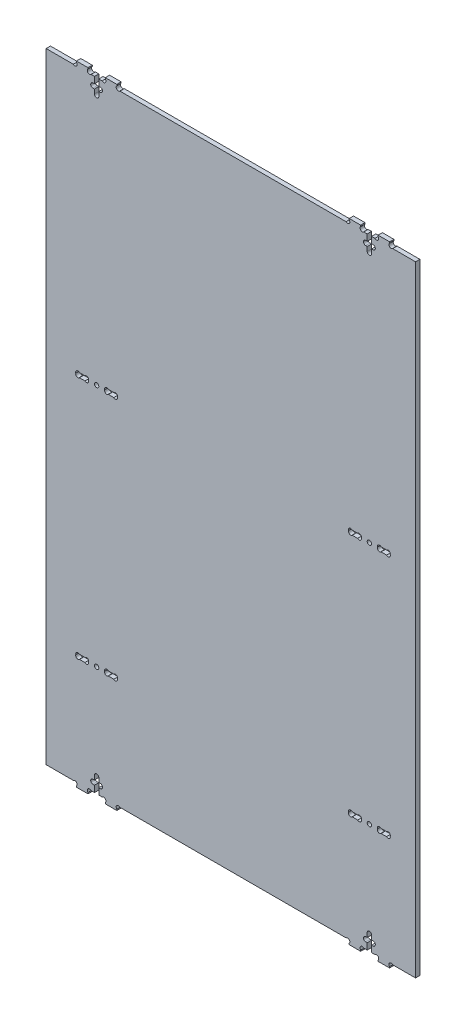
from build123d import *

# Parameters (mm, degrees)
SKETCH_1_W                      = 518
SKETCH_1_H                      = 871.6
EXTRUDE_1_DEPTH                 = 6
CUT_EXTRUDE_5_DEPTH             = 677.965021253
CUT_EXTRUDE_5_DEPTH_BACK        = 677.965021253
SKETCH_5_R                      = 2.75
SKETCH_5_W                      = 16.15
SKETCH_5_H                      = 6.15
SKETCH_5_W_2                    = 322
SKETCH_5_H_2                    = 6
SKETCH_5_W_3                    = 42.1
CUT_EXTRUDE_6_01_DEPTH          = 677.965021253
CUT_EXTRUDE_6_01_DEPTH_BACK     = 677.965021253
SKETCH_6_01_W                   = 6
SKETCH_6_01_H                   = 21.2
CUT_EXTRUDE_6_01_2_DEPTH        = 677.965021253
CUT_EXTRUDE_6_01_2_DEPTH_BACK   = 677.965021253
SKETCH_6_01_2_W                 = 10.3
SKETCH_6_01_2_H                 = 6.2
CUT_EXTRUDE_6_01_1_DEPTH        = 677.965021253
CUT_EXTRUDE_6_01_1_DEPTH_BACK   = 677.965021253
SKETCH_6_01_1_R                 = 3.05
CUT_EXTRUDE_6_01_1_2_DEPTH      = 677.965021253
CUT_EXTRUDE_6_01_1_2_DEPTH_BACK = 677.965021253
SKETCH_6_01_1_2_R               = 3.05
CUT_EXTRUDE_6_01_3_DEPTH        = 677.965021253
CUT_EXTRUDE_6_01_3_DEPTH_BACK   = 677.965021253
SKETCH_6_01_3_R                 = 3
CUT_EXTRUDE_6_02_DEPTH          = 677.965021253
CUT_EXTRUDE_6_02_DEPTH_BACK     = 677.965021253
SKETCH_6_02_W                   = 6
SKETCH_6_02_H                   = 21.2
CUT_EXTRUDE_6_02_2_DEPTH        = 677.965021253
CUT_EXTRUDE_6_02_2_DEPTH_BACK   = 677.965021253
SKETCH_6_02_2_W                 = 10.3
SKETCH_6_02_2_H                 = 6.2
CUT_EXTRUDE_6_02_1_DEPTH        = 677.965021253
CUT_EXTRUDE_6_02_1_DEPTH_BACK   = 677.965021253
SKETCH_6_02_1_R                 = 3.05
CUT_EXTRUDE_6_02_1_2_DEPTH      = 677.965021253
CUT_EXTRUDE_6_02_1_2_DEPTH_BACK = 677.965021253
SKETCH_6_02_1_2_R               = 3.05
CUT_EXTRUDE_6_02_3_DEPTH        = 677.965021253
CUT_EXTRUDE_6_02_3_DEPTH_BACK   = 677.965021253
SKETCH_6_02_3_R                 = 3
CUT_EXTRUDE_6_03_DEPTH          = 677.965021253
CUT_EXTRUDE_6_03_DEPTH_BACK     = 677.965021253
SKETCH_6_03_W                   = 6
SKETCH_6_03_H                   = 21.2
CUT_EXTRUDE_6_03_2_DEPTH        = 677.965021253
CUT_EXTRUDE_6_03_2_DEPTH_BACK   = 677.965021253
SKETCH_6_03_2_W                 = 10.3
SKETCH_6_03_2_H                 = 6.2
CUT_EXTRUDE_6_03_1_DEPTH        = 677.965021253
CUT_EXTRUDE_6_03_1_DEPTH_BACK   = 677.965021253
SKETCH_6_03_1_R                 = 3.05
CUT_EXTRUDE_6_03_1_2_DEPTH      = 677.965021253
CUT_EXTRUDE_6_03_1_2_DEPTH_BACK = 677.965021253
SKETCH_6_03_1_2_R               = 3.05
CUT_EXTRUDE_6_03_3_DEPTH        = 677.965021253
CUT_EXTRUDE_6_03_3_DEPTH_BACK   = 677.965021253
SKETCH_6_03_3_R                 = 3
CUT_EXTRUDE_6_04_DEPTH          = 677.965021253
CUT_EXTRUDE_6_04_DEPTH_BACK     = 677.965021253
SKETCH_6_04_W                   = 6
SKETCH_6_04_H                   = 21.2
CUT_EXTRUDE_6_04_2_DEPTH        = 677.965021253
CUT_EXTRUDE_6_04_2_DEPTH_BACK   = 677.965021253
SKETCH_6_04_2_W                 = 10.3
SKETCH_6_04_2_H                 = 6.2
CUT_EXTRUDE_6_04_1_DEPTH        = 677.965021253
CUT_EXTRUDE_6_04_1_DEPTH_BACK   = 677.965021253
SKETCH_6_04_1_R                 = 3.05
CUT_EXTRUDE_6_04_1_2_DEPTH      = 677.965021253
CUT_EXTRUDE_6_04_1_2_DEPTH_BACK = 677.965021253
SKETCH_6_04_1_2_R               = 3.05
CUT_EXTRUDE_6_04_3_DEPTH        = 677.965021253
CUT_EXTRUDE_6_04_3_DEPTH_BACK   = 677.965021253
SKETCH_6_04_3_R                 = 3
CUT_EXTRUDE_01_DEPTH            = 677.965021253
CUT_EXTRUDE_01_DEPTH_BACK       = 677.965021253
SKETCH_01_R                     = 3.05
CUT_EXTRUDE_02_DEPTH            = 677.965021253
CUT_EXTRUDE_02_DEPTH_BACK       = 677.965021253
SKETCH_02_R                     = 3.05
CUT_EXTRUDE_03_DEPTH            = 677.965021253
CUT_EXTRUDE_03_DEPTH_BACK       = 677.965021253
SKETCH_03_R                     = 3.05
CUT_EXTRUDE_04_DEPTH            = 677.965021253
CUT_EXTRUDE_04_DEPTH_BACK       = 677.965021253
SKETCH_04_R                     = 3.05
SKETCH_6_01_4_R                 = 10
EXTRUDE_6_01_20_DEPTH           = 6
CUT_EXTRUDE_6_01_4_DEPTH        = 677.965021253
CUT_EXTRUDE_6_01_4_DEPTH_BACK   = 677.965021253
SKETCH_6_01_5_R                 = 3
SKETCH_6_02_4_R                 = 10
EXTRUDE_6_02_20_DEPTH           = 6
CUT_EXTRUDE_6_02_4_DEPTH        = 677.965021253
CUT_EXTRUDE_6_02_4_DEPTH_BACK   = 677.965021253
SKETCH_6_02_5_R                 = 3
SKETCH_6_03_4_R                 = 10
EXTRUDE_6_03_20_DEPTH           = 6
CUT_EXTRUDE_6_03_4_DEPTH        = 677.965021253
CUT_EXTRUDE_6_03_4_DEPTH_BACK   = 677.965021253
SKETCH_6_03_5_R                 = 3
SKETCH_6_04_4_R                 = 10
EXTRUDE_6_04_20_DEPTH           = 6
CUT_EXTRUDE_6_04_4_DEPTH        = 677.965021253
CUT_EXTRUDE_6_04_4_DEPTH_BACK   = 677.965021253
SKETCH_6_04_5_R                 = 3


with BuildPart() as part:
    # Эскиз1 → Бобышка-Вытянуть1 (new body)
    with BuildSketch(Plane.XY):
        with Locations((-259, 0)):
            Rectangle(SKETCH_1_W, SKETCH_1_H)
    extrude(amount=-EXTRUDE_1_DEPTH)

    # Стыки_эскиз_пазов_и_стяжек_М5 → Стыки_шип_паз_стяжки_М5 (cut, two sides: drawn at the far end of the back side and taken through both)
    with BuildSketch(Plane.XY.offset(-CUT_EXTRUDE_5_DEPTH_BACK)):
        with Locations((-448, -277.2)):
            Circle(SKETCH_5_R)
        with Locations((-448, 60.8)):
            Circle(SKETCH_5_R)
        with Locations((-70, -277.2)):
            Circle(SKETCH_5_R)
        with Locations((-70, 60.8)):
            Circle(SKETCH_5_R)
        Polygon((-72.75, -415.65), (-74.15, -415.65), (-74.15, -419.95), (-72.75, -419.95), (-72.75, -429.8), (-82, -429.8), (-82, -435.8), (-72.75, -435.8), (-72.75, -435.9), (-67.25, -435.9), (-67.25, -435.8), (-58, -435.8), (-58, -429.8), (-67.25, -429.8), (-67.25, -419.95), (-65.85, -419.95), (-65.85, -415.65), (-67.25, -415.65), (-67.25, -408.8), (-72.75, -408.8), align=None)
        Polygon((-445.25, 419.95), (-445.25, 429.8), (-436, 429.8), (-436, 435.8), (-445.25, 435.8), (-445.25, 435.9), (-450.75, 435.9), (-450.75, 435.8), (-460, 435.8), (-460, 429.8), (-450.75, 429.8), (-450.75, 419.95), (-452.15, 419.95), (-452.15, 415.65), (-450.75, 415.65), (-450.75, 408.8), (-445.25, 408.8), (-445.25, 415.65), (-443.85, 415.65), (-443.85, 419.95), align=None)
        Polygon((-6, -429.8), (-42, -429.8), (-42, -435.8), (0.1, -435.8), (0.1, -429.8), (0, -429.8), (0, 429.8), (0.1, 429.8), (0.1, 435.8), (-42, 435.8), (-42, 429.8), (-6, 429.8), align=None)
        Polygon((-67.25, 435.8), (-67.25, 435.9), (-72.75, 435.9), (-72.75, 435.8), (-82, 435.8), (-82, 429.8), (-72.75, 429.8), (-72.75, 419.95), (-74.15, 419.95), (-74.15, 415.65), (-72.75, 415.65), (-72.75, 408.8), (-67.25, 408.8), (-67.25, 415.65), (-65.85, 415.65), (-65.85, 419.95), (-67.25, 419.95), (-67.25, 429.8), (-58, 429.8), (-58, 435.8), align=None)
        with Locations((-468, 60.8)):
            Rectangle(SKETCH_5_W, SKETCH_5_H)
        with Locations((-259, -432.8)):
            Rectangle(SKETCH_5_W_2, SKETCH_5_H_2)
        with Locations((-90, -277.2)):
            Rectangle(SKETCH_5_W, SKETCH_5_H)
        with Locations((-497.05, 432.8)):
            Rectangle(SKETCH_5_W_3, SKETCH_5_H_2)
        with Locations((-90, 60.8)):
            Rectangle(SKETCH_5_W, SKETCH_5_H)
        with Locations((-50, 60.8)):
            Rectangle(SKETCH_5_W, SKETCH_5_H)
        Polygon((-443.85, -419.95), (-443.85, -415.65), (-445.25, -415.65), (-445.25, -408.8), (-450.75, -408.8), (-450.75, -415.65), (-452.15, -415.65), (-452.15, -419.95), (-450.75, -419.95), (-450.75, -429.8), (-460, -429.8), (-460, -435.8), (-450.75, -435.8), (-450.75, -435.9), (-445.25, -435.9), (-445.25, -435.8), (-436, -435.8), (-436, -429.8), (-445.25, -429.8), (-445.25, -419.95), align=None)
        with Locations((-468, -277.2)):
            Rectangle(SKETCH_5_W, SKETCH_5_H)
        with Locations((-50, -277.2)):
            Rectangle(SKETCH_5_W, SKETCH_5_H)
        with Locations((-428, -277.2)):
            Rectangle(SKETCH_5_W, SKETCH_5_H)
        with Locations((-428, 60.8)):
            Rectangle(SKETCH_5_W, SKETCH_5_H)
        with Locations((-497.05, -432.8)):
            Rectangle(SKETCH_5_W_3, SKETCH_5_H_2)
        with Locations((-259, 432.8)):
            Rectangle(SKETCH_5_W_2, SKETCH_5_H_2)
    extrude(amount=CUT_EXTRUDE_5_DEPTH + CUT_EXTRUDE_5_DEPTH_BACK, mode=Mode.SUBTRACT)

    # Sketch 6_01 → Cut-Extrude 6_01 (cut, two sides: drawn at the far end of the back side and taken through both)
    with BuildSketch(Plane.XY.offset(-CUT_EXTRUDE_6_01_DEPTH_BACK)):
        with Locations((-70, -419.3)):
            Rectangle(SKETCH_6_01_W, SKETCH_6_01_H)
    extrude(amount=CUT_EXTRUDE_6_01_DEPTH + CUT_EXTRUDE_6_01_DEPTH_BACK, mode=Mode.SUBTRACT)

    # Sketch 6_01 2 → Cut-Extrude 6_01 2 (cut, two sides: drawn at the far end of the back side and taken through both)
    with BuildSketch(Plane.XY.offset(-CUT_EXTRUDE_6_01_2_DEPTH_BACK)):
        with Locations((-70, -417.8)):
            Rectangle(SKETCH_6_01_2_W, SKETCH_6_01_2_H)
    extrude(amount=CUT_EXTRUDE_6_01_2_DEPTH + CUT_EXTRUDE_6_01_2_DEPTH_BACK, mode=Mode.SUBTRACT)

    # Sketch 6_01_____1 → Cut-Extrude 6_01_____1 (cut, two sides: drawn at the far end of the back side and taken through both)
    with BuildSketch(Plane.XY.offset(-CUT_EXTRUDE_6_01_1_DEPTH_BACK)):
        with Locations((-64.85, -417.75)):
            Circle(SKETCH_6_01_1_R)
        with Locations((-75.15, -417.75)):
            Circle(SKETCH_6_01_1_R)
    extrude(amount=CUT_EXTRUDE_6_01_1_DEPTH + CUT_EXTRUDE_6_01_1_DEPTH_BACK, mode=Mode.SUBTRACT)

    # Sketch 6_01_____-1 2 → Cut-Extrude 6_01_____-1 2 (cut, two sides: drawn at the far end of the back side and taken through both)
    with BuildSketch(Plane.XY.offset(-CUT_EXTRUDE_6_01_1_2_DEPTH_BACK)):
        with Locations((-64.85, -417.85)):
            Circle(SKETCH_6_01_1_2_R)
        with Locations((-75.15, -417.85)):
            Circle(SKETCH_6_01_1_2_R)
    extrude(amount=CUT_EXTRUDE_6_01_1_2_DEPTH + CUT_EXTRUDE_6_01_1_2_DEPTH_BACK, mode=Mode.SUBTRACT)

    # Sketch 6_01 3 → Cut-Extrude 6_01 3 (cut, two sides: drawn at the far end of the back side and taken through both)
    with BuildSketch(Plane.XY.offset(-CUT_EXTRUDE_6_01_3_DEPTH_BACK)):
        with Locations((-70, -408.7)):
            Circle(SKETCH_6_01_3_R)
    extrude(amount=CUT_EXTRUDE_6_01_3_DEPTH + CUT_EXTRUDE_6_01_3_DEPTH_BACK, mode=Mode.SUBTRACT)

    # Sketch 6_02 → Cut-Extrude 6_02 (cut, two sides: drawn at the far end of the back side and taken through both)
    with BuildSketch(Plane.XY.offset(-CUT_EXTRUDE_6_02_DEPTH_BACK)):
        with Locations((-70, 419.3)):
            Rectangle(SKETCH_6_02_W, SKETCH_6_02_H)
    extrude(amount=CUT_EXTRUDE_6_02_DEPTH + CUT_EXTRUDE_6_02_DEPTH_BACK, mode=Mode.SUBTRACT)

    # Sketch 6_02 2 → Cut-Extrude 6_02 2 (cut, two sides: drawn at the far end of the back side and taken through both)
    with BuildSketch(Plane.XY.offset(-CUT_EXTRUDE_6_02_2_DEPTH_BACK)):
        with Locations((-70, 417.8)):
            Rectangle(SKETCH_6_02_2_W, SKETCH_6_02_2_H)
    extrude(amount=CUT_EXTRUDE_6_02_2_DEPTH + CUT_EXTRUDE_6_02_2_DEPTH_BACK, mode=Mode.SUBTRACT)

    # Sketch 6_02_____1 → Cut-Extrude 6_02_____1 (cut, two sides: drawn at the far end of the back side and taken through both)
    with BuildSketch(Plane.XY.offset(-CUT_EXTRUDE_6_02_1_DEPTH_BACK)):
        with Locations((-64.85, 417.85)):
            Circle(SKETCH_6_02_1_R)
        with Locations((-75.15, 417.85)):
            Circle(SKETCH_6_02_1_R)
    extrude(amount=CUT_EXTRUDE_6_02_1_DEPTH + CUT_EXTRUDE_6_02_1_DEPTH_BACK, mode=Mode.SUBTRACT)

    # Sketch 6_02_____-1 2 → Cut-Extrude 6_02_____-1 2 (cut, two sides: drawn at the far end of the back side and taken through both)
    with BuildSketch(Plane.XY.offset(-CUT_EXTRUDE_6_02_1_2_DEPTH_BACK)):
        with Locations((-64.85, 417.75)):
            Circle(SKETCH_6_02_1_2_R)
        with Locations((-75.15, 417.75)):
            Circle(SKETCH_6_02_1_2_R)
    extrude(amount=CUT_EXTRUDE_6_02_1_2_DEPTH + CUT_EXTRUDE_6_02_1_2_DEPTH_BACK, mode=Mode.SUBTRACT)

    # Sketch 6_02 3 → Cut-Extrude 6_02 3 (cut, two sides: drawn at the far end of the back side and taken through both)
    with BuildSketch(Plane.XY.offset(-CUT_EXTRUDE_6_02_3_DEPTH_BACK)):
        with Locations((-70, 408.7)):
            Circle(SKETCH_6_02_3_R)
    extrude(amount=CUT_EXTRUDE_6_02_3_DEPTH + CUT_EXTRUDE_6_02_3_DEPTH_BACK, mode=Mode.SUBTRACT)

    # Sketch 6_03 → Cut-Extrude 6_03 (cut, two sides: drawn at the far end of the back side and taken through both)
    with BuildSketch(Plane.XY.offset(-CUT_EXTRUDE_6_03_DEPTH_BACK)):
        with Locations((-448, 419.3)):
            Rectangle(SKETCH_6_03_W, SKETCH_6_03_H)
    extrude(amount=CUT_EXTRUDE_6_03_DEPTH + CUT_EXTRUDE_6_03_DEPTH_BACK, mode=Mode.SUBTRACT)

    # Sketch 6_03 2 → Cut-Extrude 6_03 2 (cut, two sides: drawn at the far end of the back side and taken through both)
    with BuildSketch(Plane.XY.offset(-CUT_EXTRUDE_6_03_2_DEPTH_BACK)):
        with Locations((-448, 417.8)):
            Rectangle(SKETCH_6_03_2_W, SKETCH_6_03_2_H)
    extrude(amount=CUT_EXTRUDE_6_03_2_DEPTH + CUT_EXTRUDE_6_03_2_DEPTH_BACK, mode=Mode.SUBTRACT)

    # Sketch 6_03_____1 → Cut-Extrude 6_03_____1 (cut, two sides: drawn at the far end of the back side and taken through both)
    with BuildSketch(Plane.XY.offset(-CUT_EXTRUDE_6_03_1_DEPTH_BACK)):
        with Locations((-442.85, 417.85)):
            Circle(SKETCH_6_03_1_R)
        with Locations((-453.15, 417.85)):
            Circle(SKETCH_6_03_1_R)
    extrude(amount=CUT_EXTRUDE_6_03_1_DEPTH + CUT_EXTRUDE_6_03_1_DEPTH_BACK, mode=Mode.SUBTRACT)

    # Sketch 6_03_____-1 2 → Cut-Extrude 6_03_____-1 2 (cut, two sides: drawn at the far end of the back side and taken through both)
    with BuildSketch(Plane.XY.offset(-CUT_EXTRUDE_6_03_1_2_DEPTH_BACK)):
        with Locations((-442.85, 417.75)):
            Circle(SKETCH_6_03_1_2_R)
        with Locations((-453.15, 417.75)):
            Circle(SKETCH_6_03_1_2_R)
    extrude(amount=CUT_EXTRUDE_6_03_1_2_DEPTH + CUT_EXTRUDE_6_03_1_2_DEPTH_BACK, mode=Mode.SUBTRACT)

    # Sketch 6_03 3 → Cut-Extrude 6_03 3 (cut, two sides: drawn at the far end of the back side and taken through both)
    with BuildSketch(Plane.XY.offset(-CUT_EXTRUDE_6_03_3_DEPTH_BACK)):
        with Locations((-448, 408.7)):
            Circle(SKETCH_6_03_3_R)
    extrude(amount=CUT_EXTRUDE_6_03_3_DEPTH + CUT_EXTRUDE_6_03_3_DEPTH_BACK, mode=Mode.SUBTRACT)

    # Sketch 6_04 → Cut-Extrude 6_04 (cut, two sides: drawn at the far end of the back side and taken through both)
    with BuildSketch(Plane.XY.offset(-CUT_EXTRUDE_6_04_DEPTH_BACK)):
        with Locations((-448, -419.3)):
            Rectangle(SKETCH_6_04_W, SKETCH_6_04_H)
    extrude(amount=CUT_EXTRUDE_6_04_DEPTH + CUT_EXTRUDE_6_04_DEPTH_BACK, mode=Mode.SUBTRACT)

    # Sketch 6_04 2 → Cut-Extrude 6_04 2 (cut, two sides: drawn at the far end of the back side and taken through both)
    with BuildSketch(Plane.XY.offset(-CUT_EXTRUDE_6_04_2_DEPTH_BACK)):
        with Locations((-448, -417.8)):
            Rectangle(SKETCH_6_04_2_W, SKETCH_6_04_2_H)
    extrude(amount=CUT_EXTRUDE_6_04_2_DEPTH + CUT_EXTRUDE_6_04_2_DEPTH_BACK, mode=Mode.SUBTRACT)

    # Sketch 6_04_____1 → Cut-Extrude 6_04_____1 (cut, two sides: drawn at the far end of the back side and taken through both)
    with BuildSketch(Plane.XY.offset(-CUT_EXTRUDE_6_04_1_DEPTH_BACK)):
        with Locations((-442.85, -417.75)):
            Circle(SKETCH_6_04_1_R)
        with Locations((-453.15, -417.75)):
            Circle(SKETCH_6_04_1_R)
    extrude(amount=CUT_EXTRUDE_6_04_1_DEPTH + CUT_EXTRUDE_6_04_1_DEPTH_BACK, mode=Mode.SUBTRACT)

    # Sketch 6_04_____-1 2 → Cut-Extrude 6_04_____-1 2 (cut, two sides: drawn at the far end of the back side and taken through both)
    with BuildSketch(Plane.XY.offset(-CUT_EXTRUDE_6_04_1_2_DEPTH_BACK)):
        with Locations((-442.85, -417.85)):
            Circle(SKETCH_6_04_1_2_R)
        with Locations((-453.15, -417.85)):
            Circle(SKETCH_6_04_1_2_R)
    extrude(amount=CUT_EXTRUDE_6_04_1_2_DEPTH + CUT_EXTRUDE_6_04_1_2_DEPTH_BACK, mode=Mode.SUBTRACT)

    # Sketch 6_04 3 → Cut-Extrude 6_04 3 (cut, two sides: drawn at the far end of the back side and taken through both)
    with BuildSketch(Plane.XY.offset(-CUT_EXTRUDE_6_04_3_DEPTH_BACK)):
        with Locations((-448, -408.7)):
            Circle(SKETCH_6_04_3_R)
    extrude(amount=CUT_EXTRUDE_6_04_3_DEPTH + CUT_EXTRUDE_6_04_3_DEPTH_BACK, mode=Mode.SUBTRACT)

    # ЧПУ_Шаблон_углов_01 → ЧПУ_Разгрузки_01 (cut, two sides: drawn at the far end of the back side and taken through both)
    with BuildSketch(Plane.XY.offset(-CUT_EXTRUDE_01_DEPTH_BACK)):
        with Locations((-55.953679656, -278.153679656)):
            Circle(SKETCH_01_R)
        with Locations((-473.953679656, -278.153679656)):
            Circle(SKETCH_01_R)
        with Locations((-39.878679656, 431.921320344)):
            Circle(SKETCH_01_R)
        with Locations((-79.878679656, 431.921320344)):
            Circle(SKETCH_01_R)
        with Locations((-417.878679656, 431.921320344)):
            Circle(SKETCH_01_R)
        with Locations((-457.878679656, 431.921320344)):
            Circle(SKETCH_01_R)
        with Locations((-55.953679656, 59.846320344)):
            Circle(SKETCH_01_R)
        with Locations((-433.953679656, 59.846320344)):
            Circle(SKETCH_01_R)
        with Locations((-433.953679656, -278.153679656)):
            Circle(SKETCH_01_R)
        with Locations((-473.953679656, 59.846320344)):
            Circle(SKETCH_01_R)
        with Locations((-95.953679656, -278.153679656)):
            Circle(SKETCH_01_R)
        with Locations((-95.953679656, 59.846320344)):
            Circle(SKETCH_01_R)
    extrude(amount=CUT_EXTRUDE_01_DEPTH + CUT_EXTRUDE_01_DEPTH_BACK, mode=Mode.SUBTRACT)

    # ЧПУ_Шаблон_углов_02 → ЧПУ_Разгрузки_02 (cut, two sides: drawn at the far end of the back side and taken through both)
    with BuildSketch(Plane.XY.offset(-CUT_EXTRUDE_02_DEPTH_BACK)):
        with Locations((-55.953679656, -276.246320344)):
            Circle(SKETCH_02_R)
        with Locations((-473.953679656, -276.246320344)):
            Circle(SKETCH_02_R)
        with Locations((-417.878679656, -431.921320344)):
            Circle(SKETCH_02_R)
        with Locations((-79.878679656, -431.921320344)):
            Circle(SKETCH_02_R)
        with Locations((-39.878679656, -431.921320344)):
            Circle(SKETCH_02_R)
        with Locations((-457.878679656, -431.921320344)):
            Circle(SKETCH_02_R)
        with Locations((-55.953679656, 61.753679656)):
            Circle(SKETCH_02_R)
        with Locations((-433.953679656, 61.753679656)):
            Circle(SKETCH_02_R)
        with Locations((-433.953679656, -276.246320344)):
            Circle(SKETCH_02_R)
        with Locations((-473.953679656, 61.753679656)):
            Circle(SKETCH_02_R)
        with Locations((-95.953679656, -276.246320344)):
            Circle(SKETCH_02_R)
        with Locations((-95.953679656, 61.753679656)):
            Circle(SKETCH_02_R)
    extrude(amount=CUT_EXTRUDE_02_DEPTH + CUT_EXTRUDE_02_DEPTH_BACK, mode=Mode.SUBTRACT)

    # ЧПУ_Шаблон_углов_03 → ЧПУ_Разгрузки_03 (cut, two sides: drawn at the far end of the back side and taken through both)
    with BuildSketch(Plane.XY.offset(-CUT_EXTRUDE_03_DEPTH_BACK)):
        with Locations((-44.046320344, -278.153679656)):
            Circle(SKETCH_03_R)
        with Locations((-462.046320344, -278.153679656)):
            Circle(SKETCH_03_R)
        with Locations((-60.121320344, 431.921320344)):
            Circle(SKETCH_03_R)
        with Locations((-100.121320344, 431.921320344)):
            Circle(SKETCH_03_R)
        with Locations((-438.121320344, 431.921320344)):
            Circle(SKETCH_03_R)
        with Locations((-478.121320344, 431.921320344)):
            Circle(SKETCH_03_R)
        with Locations((-44.046320344, 59.846320344)):
            Circle(SKETCH_03_R)
        with Locations((-422.046320344, 59.846320344)):
            Circle(SKETCH_03_R)
        with Locations((-422.046320344, -278.153679656)):
            Circle(SKETCH_03_R)
        with Locations((-462.046320344, 59.846320344)):
            Circle(SKETCH_03_R)
        with Locations((-84.046320344, -278.153679656)):
            Circle(SKETCH_03_R)
        with Locations((-84.046320344, 59.846320344)):
            Circle(SKETCH_03_R)
    extrude(amount=CUT_EXTRUDE_03_DEPTH + CUT_EXTRUDE_03_DEPTH_BACK, mode=Mode.SUBTRACT)

    # ЧПУ_Шаблон_углов_04 → ЧПУ_Разгрузки_04 (cut, two sides: drawn at the far end of the back side and taken through both)
    with BuildSketch(Plane.XY.offset(-CUT_EXTRUDE_04_DEPTH_BACK)):
        with Locations((-44.046320344, -276.246320344)):
            Circle(SKETCH_04_R)
        with Locations((-462.046320344, -276.246320344)):
            Circle(SKETCH_04_R)
        with Locations((-100.121320344, -431.921320344)):
            Circle(SKETCH_04_R)
        with Locations((-60.121320344, -431.921320344)):
            Circle(SKETCH_04_R)
        with Locations((-478.121320344, -431.921320344)):
            Circle(SKETCH_04_R)
        with Locations((-438.121320344, -431.921320344)):
            Circle(SKETCH_04_R)
        with Locations((-44.046320344, 61.753679656)):
            Circle(SKETCH_04_R)
        with Locations((-422.046320344, 61.753679656)):
            Circle(SKETCH_04_R)
        with Locations((-422.046320344, -276.246320344)):
            Circle(SKETCH_04_R)
        with Locations((-462.046320344, 61.753679656)):
            Circle(SKETCH_04_R)
        with Locations((-84.046320344, -276.246320344)):
            Circle(SKETCH_04_R)
        with Locations((-84.046320344, 61.753679656)):
            Circle(SKETCH_04_R)
    extrude(amount=CUT_EXTRUDE_04_DEPTH + CUT_EXTRUDE_04_DEPTH_BACK, mode=Mode.SUBTRACT)

    # Sketch 6_01 4 → ЧПУ_Проход_М6_01_Ушко20 (add)
    with BuildSketch(Plane.XY):
        with Locations((-448, -277.2)):
            Circle(SKETCH_6_01_4_R)
    extrude(amount=-EXTRUDE_6_01_20_DEPTH)

    # Sketch 6_01 5 → Cut-Extrude 6_01 4 (cut, two sides: drawn at the far end of the back side and taken through both)
    with BuildSketch(Plane.XY.offset(-CUT_EXTRUDE_6_01_4_DEPTH_BACK)):
        with Locations((-448, -277.2)):
            Circle(SKETCH_6_01_5_R)
    extrude(amount=CUT_EXTRUDE_6_01_4_DEPTH + CUT_EXTRUDE_6_01_4_DEPTH_BACK, mode=Mode.SUBTRACT)

    # Sketch 6_02 4 → ЧПУ_Проход_М6_02_Ушко20 (add)
    with BuildSketch(Plane.XY):
        with Locations((-448, 60.8)):
            Circle(SKETCH_6_02_4_R)
    extrude(amount=-EXTRUDE_6_02_20_DEPTH)

    # Sketch 6_02 5 → Cut-Extrude 6_02 4 (cut, two sides: drawn at the far end of the back side and taken through both)
    with BuildSketch(Plane.XY.offset(-CUT_EXTRUDE_6_02_4_DEPTH_BACK)):
        with Locations((-448, 60.8)):
            Circle(SKETCH_6_02_5_R)
    extrude(amount=CUT_EXTRUDE_6_02_4_DEPTH + CUT_EXTRUDE_6_02_4_DEPTH_BACK, mode=Mode.SUBTRACT)

    # Sketch 6_03 4 → ЧПУ_Проход_М6_03_Ушко20 (add)
    with BuildSketch(Plane.XY):
        with Locations((-70, -277.2)):
            Circle(SKETCH_6_03_4_R)
    extrude(amount=-EXTRUDE_6_03_20_DEPTH)

    # Sketch 6_03 5 → Cut-Extrude 6_03 4 (cut, two sides: drawn at the far end of the back side and taken through both)
    with BuildSketch(Plane.XY.offset(-CUT_EXTRUDE_6_03_4_DEPTH_BACK)):
        with Locations((-70, -277.2)):
            Circle(SKETCH_6_03_5_R)
    extrude(amount=CUT_EXTRUDE_6_03_4_DEPTH + CUT_EXTRUDE_6_03_4_DEPTH_BACK, mode=Mode.SUBTRACT)

    # Sketch 6_04 4 → ЧПУ_Проход_М6_04_Ушко20 (add)
    with BuildSketch(Plane.XY):
        with Locations((-70, 60.8)):
            Circle(SKETCH_6_04_4_R)
    extrude(amount=-EXTRUDE_6_04_20_DEPTH)

    # Sketch 6_04 5 → Cut-Extrude 6_04 4 (cut, two sides: drawn at the far end of the back side and taken through both)
    with BuildSketch(Plane.XY.offset(-CUT_EXTRUDE_6_04_4_DEPTH_BACK)):
        with Locations((-70, 60.8)):
            Circle(SKETCH_6_04_5_R)
    extrude(amount=CUT_EXTRUDE_6_04_4_DEPTH + CUT_EXTRUDE_6_04_4_DEPTH_BACK, mode=Mode.SUBTRACT)


solid = part.part
